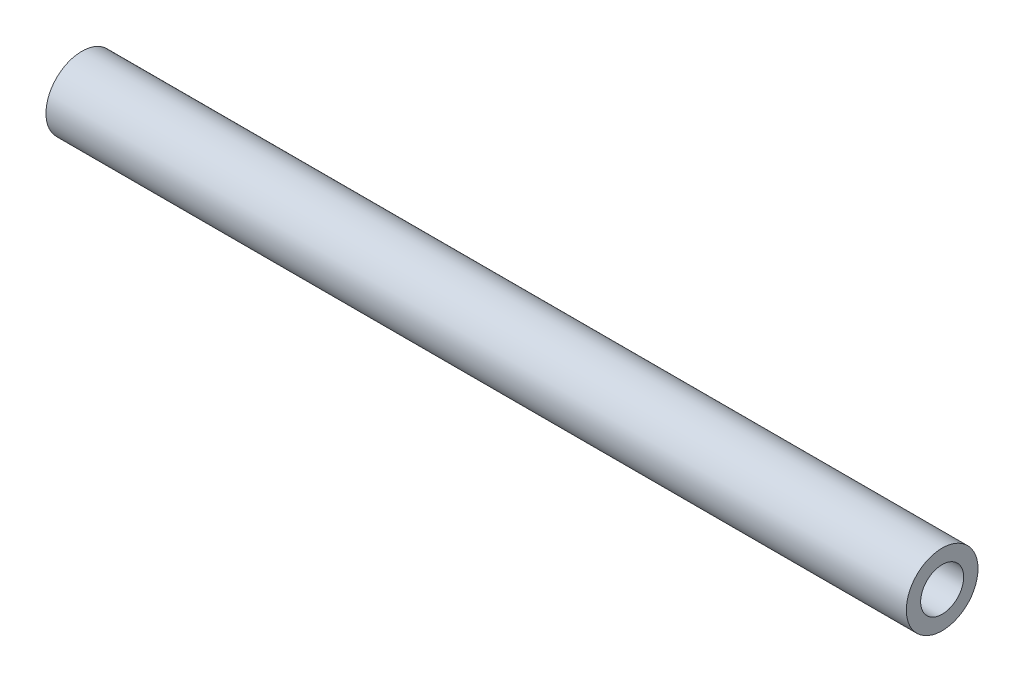
from build123d import *

# Parameters (mm, degrees)
SKETCH1_R           = 7.9375
SKETCH1_R_2         = 4.7625
BOSS_EXTRUDE1_DEPTH = 95.25


with BuildPart() as part:
    # Sketch1 → Boss-Extrude1 (new, symmetric)
    with BuildSketch(Plane(origin=(0, 0, 0), x_dir=(0, 0, -1), z_dir=(1, 0, 0))):
        Circle(SKETCH1_R)
        Circle(SKETCH1_R_2, mode=Mode.SUBTRACT)
    extrude(amount=BOSS_EXTRUDE1_DEPTH, both=True)


solid = part.part
